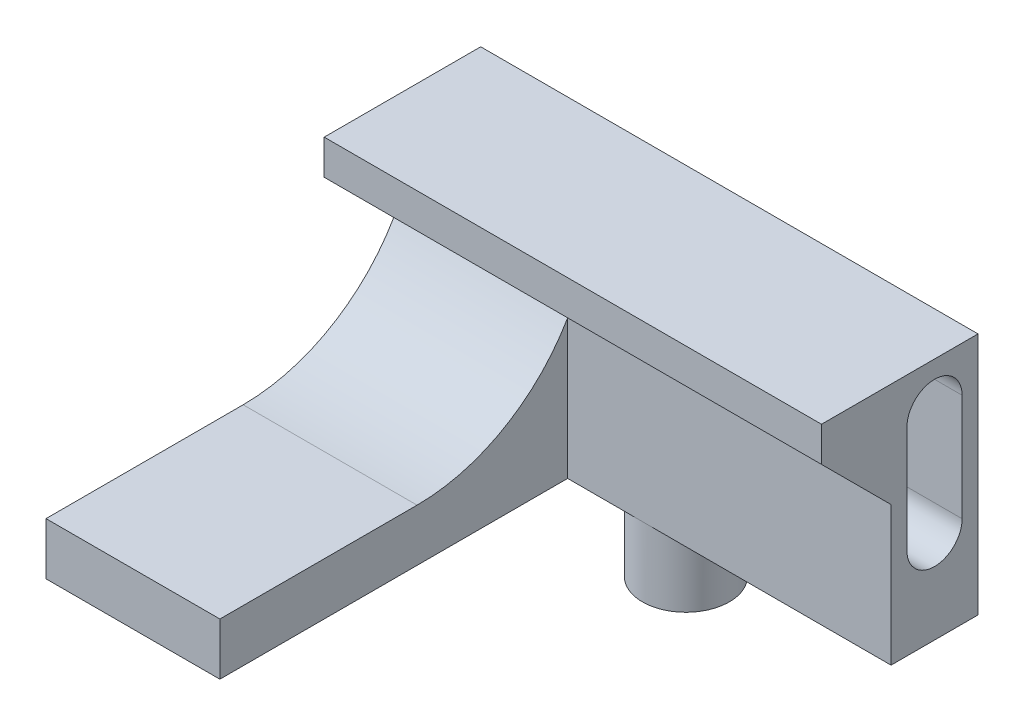
from build123d import *

# Parameters (mm, degrees)
SKETCH1_W           = 28.6
SKETCH1_H           = 5
BOSS_EXTRUDE1_DEPTH = 14
CUT_EXTRUDE1_DEPTH  = 4
SKETCH5_R           = 2.5
BOSS_EXTRUDE4_DEPTH = 4
BOSS_EXTRUDE5_DEPTH = 28.6
SKETCH7_W           = 20
SKETCH7_H           = 3
BOSS_EXTRUDE6_DEPTH = 10
FILLET1_R           = 10


with BuildPart() as part:
    # Sketch1 → Boss-Extrude1 (new body)
    with BuildSketch(Plane(origin=(0, 0, 0), x_dir=(1, 0, 0), z_dir=(0, 1, 0))):
        Rectangle(SKETCH1_W, SKETCH1_H)
    extrude(amount=BOSS_EXTRUDE1_DEPTH)

    # Sketch2 → Cut-Extrude1 (cut)
    with BuildSketch(Plane(origin=(14.3, 0, 0), x_dir=(0, 0, -1), z_dir=(1, 0, 0))):
        with BuildLine():
            Line((-1.5875, 5.25), (-1.5875, 11.4))
            ThreePointArc((-1.5875, 11.4), (0, 12.9875), (1.5875, 11.4))
            Line((1.5875, 11.4), (1.5875, 5.25))
            ThreePointArc((1.5875, 5.25), (0, 3.6625), (-1.5875, 5.25))
        make_face()
    cut_extrude1 = extrude(amount=-CUT_EXTRUDE1_DEPTH, mode=Mode.SUBTRACT)

    # Sketch5 → Boss-Extrude4 (add)
    with BuildSketch(Plane.XZ):
        with Locations(Location((0, 0, 0), (0, 0, 270))):
            Circle(SKETCH5_R)
    extrude(amount=BOSS_EXTRUDE4_DEPTH)

    # Sketch6 → Boss-Extrude5 (add)
    with BuildSketch(Plane(origin=(14.3, 0, 0), x_dir=(0, 0, -1), z_dir=(1, 0, 0))):
        Polygon((-2.5, 14), (-6.5, 14), (-6.5, 12), (-2.5, 8), align=None)
    extrude(amount=-BOSS_EXTRUDE5_DEPTH)

    # Mirror1: Cut-Extrude1 across plane
    add(cut_extrude1.mirror(Plane(origin=(0, 0, 0), x_dir=(0, 0, 1), z_dir=(1, 0, 0))), mode=Mode.SUBTRACT)

    # Sketch7 → Boss-Extrude6 (add)
    with BuildSketch(Plane.ZY.offset(14.3)):
        with Locations((12.5, 1.5)):
            Rectangle(SKETCH7_W, SKETCH7_H)
    extrude(amount=-BOSS_EXTRUDE6_DEPTH)

    # Fillet1
    # the kernel refuses this fillet: 10 mm, written as the material it adds along each edge
    with BuildSketch(Plane(origin=(-14.3, 3, 2.5), x_dir=(0, 1, 0), z_dir=(1, 0, 0))) as fillet1_piece_1:
        with BuildLine():
            CenterArc((10, 8.660254038), FILLET1_R, 180, 60)
            Line((0, 8.660254038), (-0.2, 8.660254038))
            Line((-0.2, 8.660254038), (-0.2, 0))
            Line((-0.2, 0), (0, -0.2))
            ThreePointArc((0, -0.2), (2.5, -0.2), (4.9, -0.173205081))
            Line((4.9, -0.173205081), (5, 0))
        make_face()
    extrude(amount=10)


solid = part.part
